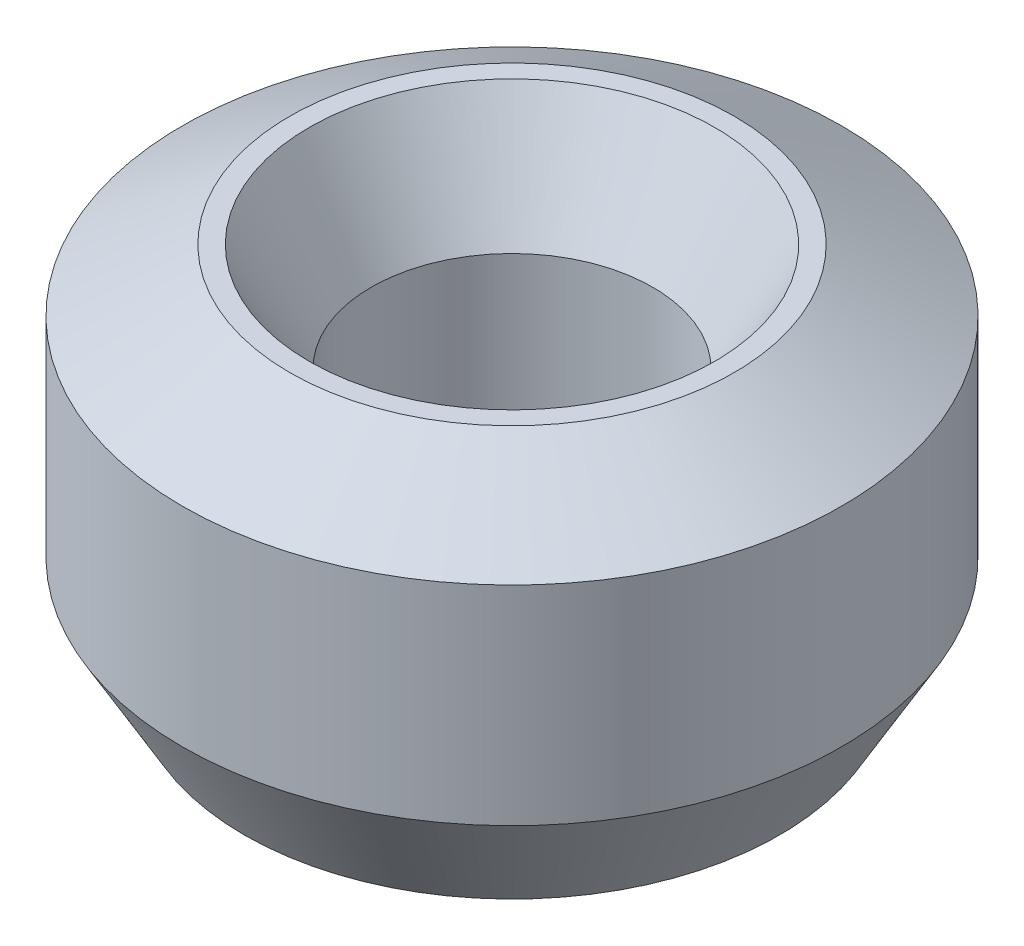
from build123d import *
from OCP.BRepFilletAPI import BRepFilletAPI_MakeChamfer

# Parameters (mm, degrees)
SKETCH1_R           = 7.5
BOSS_EXTRUDE1_DEPTH = 8.597878907
SKETCH2_R           = 3.202813622
CUT_EXTRUDE1_DEPTH  = 14.653699927
CHAMFER1_SIZE       = 1.41103144
CHAMFER1_SIZE2      = 2.443978146


with BuildPart() as part:
    # Sketch1 → Boss-Extrude1 (new body)
    with BuildSketch(Plane(origin=(0, 0, 0), x_dir=(1, 0, 0), z_dir=(0, 1, 0))):
        Circle(SKETCH1_R)
    extrude(amount=BOSS_EXTRUDE1_DEPTH)

    # Sketch2 → Cut-Extrude1 (cut, through all)
    with BuildSketch(Plane(origin=(0, 0, 0), x_dir=(1, 0, 0), z_dir=(0, 1, 0))):
        Circle(SKETCH2_R)
    extrude(amount=CUT_EXTRUDE1_DEPTH, mode=Mode.SUBTRACT)

    # Chamfer1: one chamfer whose edges measure the first distance from different faces: ONE call of the kernel's chamfer builder (chamfer() names one face for all edges)
    chamfer1_edges_1 = [part.edges().sort_by_distance(p)[0] for p in [
        (-3.202813622, 8.597878907, 0),
    ]]
    chamfer1_side_1 = [part.faces().sort_by_distance(p)[0] for p in [
        (-7.287867966, 8.597878907, 0),
    ]]
    chamfer1_edges_2 = [part.edges().sort_by_distance(p)[0] for p in [
        (-3.202813622, 0, 0),
    ]]
    chamfer1_side_2 = [part.faces().sort_by_distance(p)[0] for p in [
        (-3.202813622, 4.298939454, 0),
    ]]
    chamfer1_edges_3 = [part.edges().sort_by_distance(p)[0] for p in [
        (-7.5, 0, 0),
    ]]
    chamfer1_side_3 = [part.faces().sort_by_distance(p)[0] for p in [
        (-7.287867966, 0, 0),
    ]]
    chamfer1_edges_4 = [part.edges().sort_by_distance(p)[0] for p in [
        (-7.5, 8.597878907, 0),
    ]]
    chamfer1_side_4 = [part.faces().sort_by_distance(p)[0] for p in [
        (-7.5, 4.298939454, 0),
    ]]
    chamfer1 = BRepFilletAPI_MakeChamfer(part.part.solid().wrapped)
    for e in chamfer1_edges_1:
        chamfer1.Add(CHAMFER1_SIZE, CHAMFER1_SIZE2, e.wrapped, chamfer1_side_1[0].wrapped)  # the first distance lies on this face
    for e in chamfer1_edges_2:
        chamfer1.Add(CHAMFER1_SIZE, CHAMFER1_SIZE2, e.wrapped, chamfer1_side_2[0].wrapped)  # the first distance lies on this face
    for e in chamfer1_edges_3:
        chamfer1.Add(CHAMFER1_SIZE, CHAMFER1_SIZE2, e.wrapped, chamfer1_side_3[0].wrapped)  # the first distance lies on this face
    for e in chamfer1_edges_4:
        chamfer1.Add(CHAMFER1_SIZE, CHAMFER1_SIZE2, e.wrapped, chamfer1_side_4[0].wrapped)  # the first distance lies on this face
    add(Compound.cast(chamfer1.Shape()), mode=Mode.REPLACE)


solid = part.part
